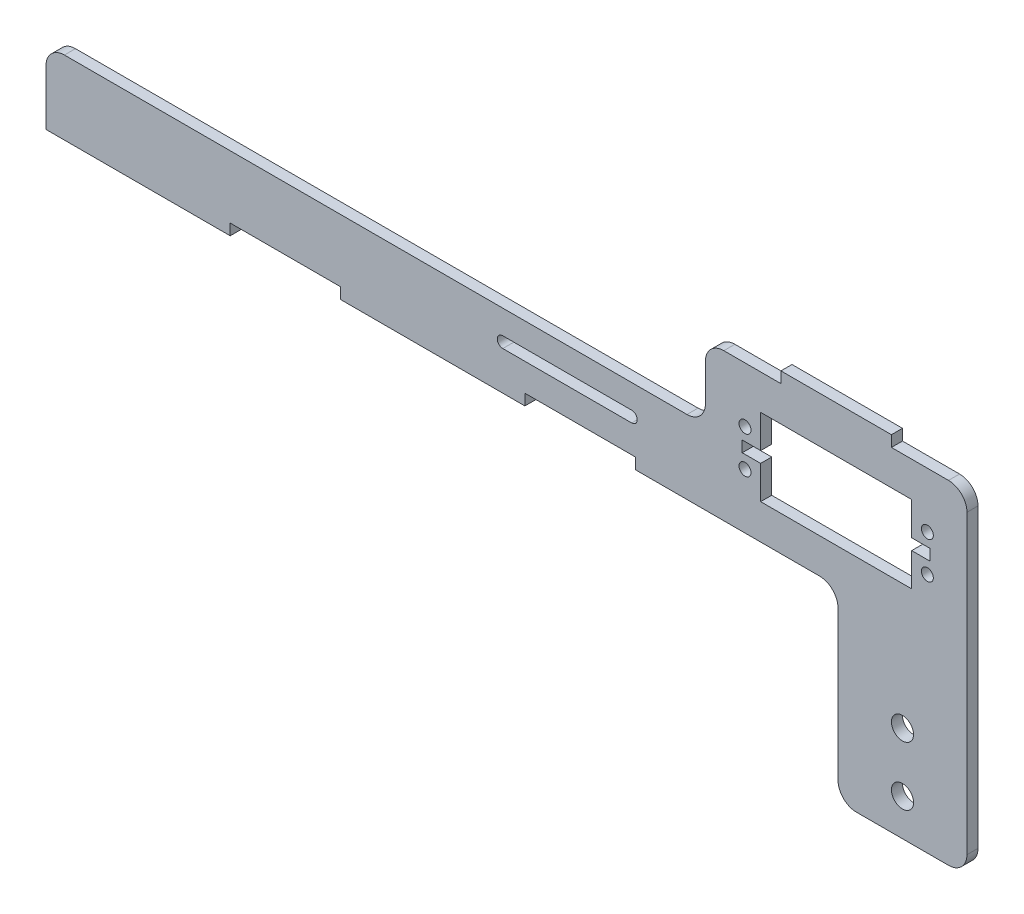
from build123d import *

# Parameters (mm, degrees)
ESBO_O1_R                = 3
ESBO_O1_R_2              = 1.625
RESSALTO_EXTRUS_O1_DEPTH = 3
FILETE1_R                = 5


with BuildPart() as part:
    # Esboço1 → Ressalto-extrusão1 (new body)
    with BuildSketch(Plane.XY):
        Polygon((160, -20), (215, -20), (215, -70.5), (250, -70.5), (250, 20), (229.5, 20), (229.5, 23), (199.5, 23), (199.5, 20), (179, 20), (179, 0), (0, 0), (0, -20), (50, -20), (50, -17), (80, -17), (80, -20), (130, -20), (130, -17), (160, -17), align=None)
        with Locations((232.5, -60.5)):
            Circle(ESBO_O1_R, mode=Mode.SUBTRACT)
        with Locations((232.5, -44.5)):
            Circle(ESBO_O1_R, mode=Mode.SUBTRACT)
        with BuildLine():
            ThreePointArc((124, -9.5), (122.5, -8), (124, -6.5))
            Line((124, -6.5), (159, -6.5))
            ThreePointArc((159, -6.5), (160.5, -8), (159, -9.5))
            Line((159, -9.5), (124, -9.5))
        make_face(mode=Mode.SUBTRACT)
        with Locations((189.75, -5)):
            Circle(ESBO_O1_R_2, mode=Mode.SUBTRACT)
        with Locations((239.25, -5)):
            Circle(ESBO_O1_R_2, mode=Mode.SUBTRACT)
        with Locations((189.75, 5)):
            Circle(ESBO_O1_R_2, mode=Mode.SUBTRACT)
        Polygon((194, 1.5), (194, 10.5), (235, 10.5), (235, 1.5), (240, 1.5), (240, -1.5), (235, -1.5), (235, -10.5), (194, -10.5), (194, -1.5), (189, -1.5), (189, 1.5), align=None, mode=Mode.SUBTRACT)
        with Locations((239.25, 5)):
            Circle(ESBO_O1_R_2, mode=Mode.SUBTRACT)
    extrude(amount=RESSALTO_EXTRUS_O1_DEPTH)

    # Filete1
    filete1_edges = [part.edges().sort_by_distance(p)[0] for p in [
        (215, -20, 1.5),
        (215, -70.5, 1.5),
        (250, -70.5, 1.5),
        (179, 0, 1.5),
        (0, 0, 1.5),
        (179, 20, 1.5),
        (250, 20, 1.5),
    ]]
    fillet(filete1_edges, radius=FILETE1_R)


solid = part.part
